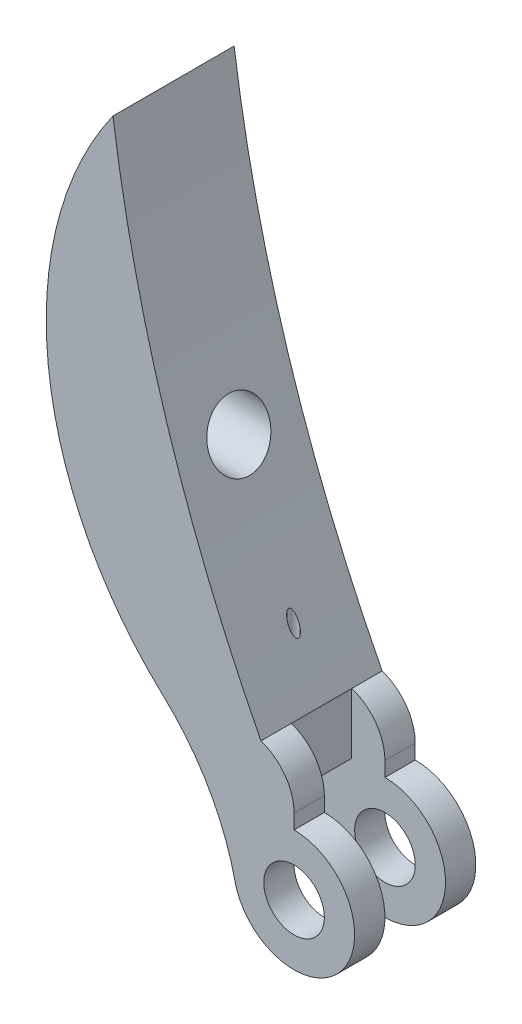
from build123d import *

# Parameters (mm, degrees)
SKETCH1_R               = 1.25
BOSS_EXTRUDE1_DEPTH     = 5
BOSS_EXTRUDE2_DEPTH     = 5
FILLET2_R               = 10
CUT_EXTRUDE2_DEPTH      = 27.814458153
CUT_EXTRUDE2_DEPTH_BACK = 27.814458153
SKETCH4_W               = 2.5
SKETCH4_H               = 5
SKETCH5_W               = 2.5
SKETCH5_H               = 2.5
CUT_EXTRUDE3_DEPTH      = 1.37
FILLET3_R               = 2
SKETCH6_R               = 1.25
CUT_EXTRUDE4_DEPTH      = 27.814458153
SKETCH7_R               = 0.2
CUT_EXTRUDE5_DEPTH      = 25.573800354


with BuildPart() as part:
    # Sketch1 → Boss-Extrude1 (new body)
    with BuildSketch(Plane.XY):
        with BuildLine():
            Line((0, 2.5), (0, 5))
            Line((0, 5), (-2.5, 5))
            Line((-2.5, 5), (-2.5, 0))
            ThreePointArc((-2.5, 0), (1.767766953, -1.767766953), (0, 2.5))
        make_face()
        Circle(SKETCH1_R, mode=Mode.SUBTRACT)
    extrude(amount=BOSS_EXTRUDE1_DEPTH)

    # Sketch2 → Boss-Extrude2 (add)
    with BuildSketch(Plane.XY.offset(5)):
        with BuildLine():
            Line((-2.5, 2.5), (0, 2.5))
            ThreePointArc((0, 2.5), (-4.79077334, 13.027539424), (-7.472558856, 24.278700341))
            ThreePointArc((-7.472558856, 24.278700341), (-9.849121132, 12.279055883), (-2.5, 2.5))
        make_face()
    extrude(amount=-BOSS_EXTRUDE2_DEPTH)

    # Fillet2
    fillet2_edges = [part.edges().sort_by_distance(p)[0] for p in [
        (-2.5, 2.5, 2.5),
    ]]
    fillet(fillet2_edges, radius=FILLET2_R)

    # Sketch4 → Cut-Extrude2 (cut, two sides: drawn at the far end of the back side and taken through both)
    with BuildSketch(Plane(origin=(0, 0, 0), x_dir=(0, 0, -1), z_dir=(1, 0, 0)).offset(-CUT_EXTRUDE2_DEPTH_BACK)):
        with Locations((-2.5, 0)):
            Rectangle(SKETCH4_W, SKETCH4_H)
    extrude(amount=CUT_EXTRUDE2_DEPTH + CUT_EXTRUDE2_DEPTH_BACK, mode=Mode.SUBTRACT)

    # Sketch5 → Cut-Extrude3 (cut)
    with BuildSketch(Plane(origin=(0, 0, 0), x_dir=(0, 0, -1), z_dir=(1, 0, 0))):
        with Locations((-2.5, 3.75)):
            Rectangle(SKETCH5_W, SKETCH5_H)
    extrude(amount=-CUT_EXTRUDE3_DEPTH, mode=Mode.SUBTRACT)

    # Fillet3
    # the kernel refuses this fillet: 2 mm, written as the material it takes off along each edge
    with BuildSketch(Plane(origin=(0, 5, -4.741540982), x_dir=(0, -1, 0), z_dir=(0, 0, 1))) as fillet3_piece_1:
        with BuildLine():
            CenterArc((1.896616393, -2), FILLET3_R, 90, 71.497208819)
            Line((0, -1.365298292), (-0.037932328, -1.352604258))
            ThreePointArc((-0.037932328, -1.352604258), (-0.04, -0.682649146), (-0.04, 0))
            Line((-0.04, 0), (0, 0.04))
            Line((0, 0.04), (1.896616393, 0.04))
            Line((1.896616393, 0.04), (1.896616393, 0))
        make_face()
    extrude(amount=10.733081965, mode=Mode.SUBTRACT)
    with BuildSketch(Plane(origin=(0, 5, -0.991540982), x_dir=(-1, 0, 0), z_dir=(0, 0, 1))) as fillet3_piece_2:
        with BuildLine():
            CenterArc((2, 1.896616393), FILLET3_R, 180, 71.497208819)
            Line((0, 1.896616393), (-0.04, 1.896616393))
            Line((-0.04, 1.896616393), (-0.04, 0))
            Line((-0.04, 0), (0, -0.04))
            ThreePointArc((0, -0.04), (0.682649146, -0.04), (1.352604258, -0.037932328))
            Line((1.352604258, -0.037932328), (1.365298292, 0))
        make_face()
    extrude(amount=10.733081965, mode=Mode.SUBTRACT)

    # Sketch6 → Cut-Extrude4 (cut, through all)
    with BuildSketch(Plane(origin=(0, 0, 0), x_dir=(0, 0, -1), z_dir=(1, 0, 0))):
        with Locations((-2.5, 13)):
            Circle(SKETCH6_R)
    extrude(amount=-CUT_EXTRUDE4_DEPTH, mode=Mode.SUBTRACT)

    # Sketch7 → Cut-Extrude5 (cut, through all)
    with BuildSketch(Plane.XZ.offset(-2.5)):
        with Locations((-2.521961644, 2.5)):
            Circle(SKETCH7_R)
    extrude(amount=-CUT_EXTRUDE5_DEPTH, mode=Mode.SUBTRACT)


solid = part.part
